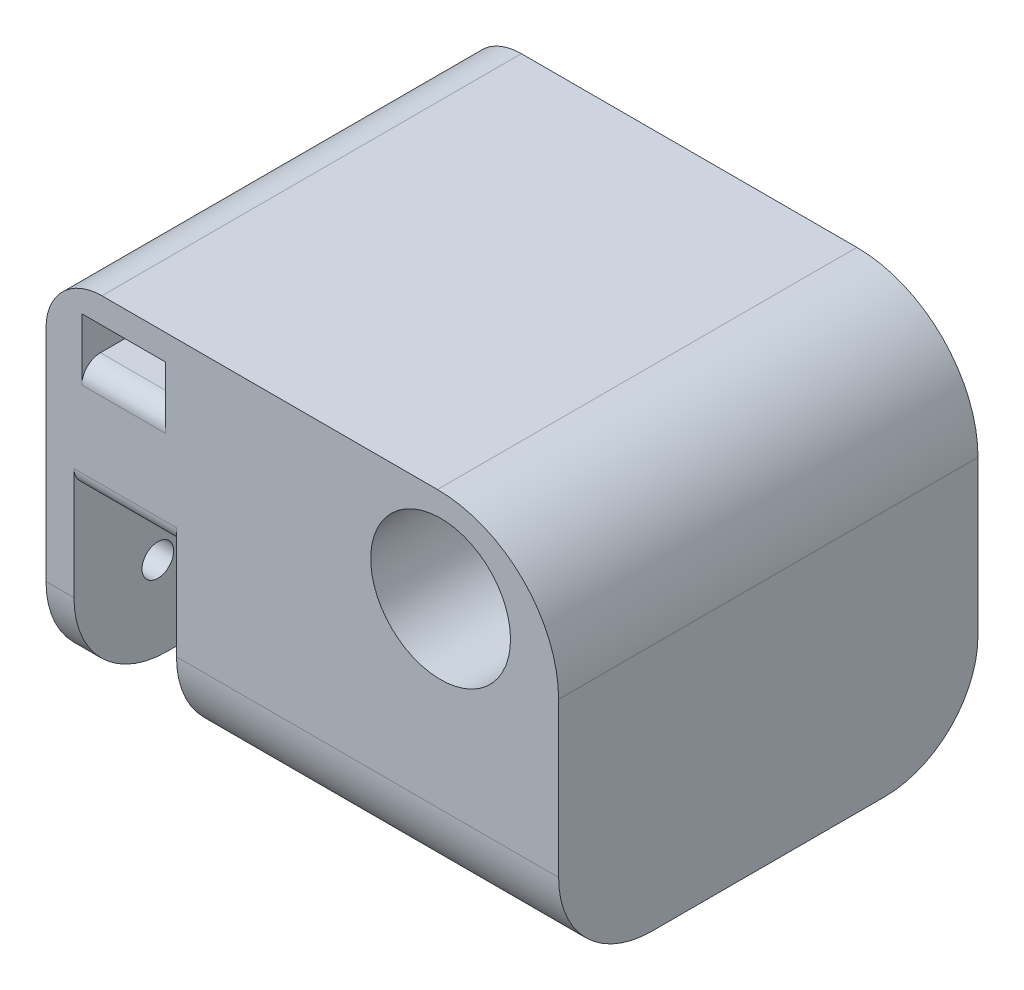
from build123d import *

# Parameters (mm, degrees)
SKETCH1_W                      = 55
SKETCH1_H                      = 39.55
SKETCH1_R                      = 7.5
BOSS_EXTRUDE1_DEPTH            = 45
SKETCH3_R                      = 4
CUT_EXTRUDE1_DEPTH             = 9.55
SKETCH4_W                      = 11
SKETCH4_H                      = 20
CUT_EXTRUDE2_DEPTH             = 65.21216785
M3_CLEARANCE_HOLE1_D           = 3.4
M3_CLEARANCE_HOLE1_DEPTH       = 32
M3_CLEARANCE_HOLE1_CSINK_D     = 3.45
M3_CLEARANCE_HOLE1_CSINK_ANGLE = 90
M3_CLEARANCE_HOLE1_TIP         = 1.021463052
SKETCH8_W                      = 9
SKETCH8_H                      = 4.627198444
CUT_EXTRUDE3_DEPTH             = 65.21216785
FILLET1_R                      = 10
FILLET2_R                      = 2
FILLET3_R                      = 6
FILLET4_R                      = 13


with BuildPart() as part:
    # Sketch1 → Boss-Extrude1 (new body)
    with BuildSketch(Plane.XY):
        with Locations((-7.5, 9.775)):
            Rectangle(SKETCH1_W, SKETCH1_H)
        with Locations((7.34, 19.55)):
            Circle(SKETCH1_R, mode=Mode.SUBTRACT)
    extrude(amount=-BOSS_EXTRUDE1_DEPTH)

    # Sketch3 → Cut-Extrude1 (cut)
    with BuildSketch(Plane.XZ.offset(10)):
        with Locations((7.34, -11.25)):
            Circle(SKETCH3_R)
        with Locations((7.34, -33.75)):
            Circle(SKETCH3_R)
    extrude(amount=-CUT_EXTRUDE1_DEPTH, mode=Mode.SUBTRACT)

    # Sketch4 → Cut-Extrude2 (cut, through all)
    with BuildSketch(Plane.XY):
        with Locations((-26.5, 0)):
            Rectangle(SKETCH4_W, SKETCH4_H)
    extrude(amount=-CUT_EXTRUDE2_DEPTH, mode=Mode.SUBTRACT)

    # M3 Clearance Hole1
    with Locations(Plane(origin=(-35, -1, -36), x_dir=(0, 0, -1), z_dir=(-1, 0, 0))):
        with Locations((0, 0), (-27, 0)):
            CounterSinkHole(M3_CLEARANCE_HOLE1_D / 2, M3_CLEARANCE_HOLE1_CSINK_D / 2, depth=M3_CLEARANCE_HOLE1_DEPTH, counter_sink_angle=M3_CLEARANCE_HOLE1_CSINK_ANGLE)
            with Locations((0, 0, -(M3_CLEARANCE_HOLE1_DEPTH + M3_CLEARANCE_HOLE1_TIP / 2))):  # 118° drill point
                Cone(0, M3_CLEARANCE_HOLE1_D / 2, M3_CLEARANCE_HOLE1_TIP, mode=Mode.SUBTRACT)

    # Sketch8 → Cut-Extrude3 (cut, through all)
    with BuildSketch(Plane.XY):
        with Locations((-26.66, 24.492052806)):
            Rectangle(SKETCH8_W, SKETCH8_H)
    extrude(amount=-CUT_EXTRUDE3_DEPTH, mode=Mode.SUBTRACT)

    # Fillet1
    # the kernel refuses this fillet: 10 mm, written as the material it takes off along each edge
    with BuildSketch(Plane(origin=(-46, -10, 0), x_dir=(0, 1, 0), z_dir=(1, 0, 0))) as fillet1_piece_1:
        with BuildLine():
            CenterArc((FILLET1_R, -FILLET1_R), FILLET1_R, 90, 90)
            Line((0, -FILLET1_R), (0, 0))
            Line((0, 0), (FILLET1_R, 0))
        make_face()
    extrude(amount=91, mode=Mode.SUBTRACT)
    with BuildSketch(Plane(origin=(-46, -10, -45), x_dir=(0, 1, 0), z_dir=(1, 0, 0))) as fillet1_piece_2:
        with BuildLine():
            CenterArc((FILLET1_R, FILLET1_R), FILLET1_R, 180, 90)
            Line((0, FILLET1_R), (0, 0))
            Line((0, 0), (FILLET1_R, 0))
        make_face()
    extrude(amount=91, mode=Mode.SUBTRACT)
    with BuildSketch(Plane(origin=(-60, -10, 0), x_dir=(0, 1, 0), z_dir=(1, 0, 0))) as fillet1_piece_3:
        with BuildLine():
            CenterArc((FILLET1_R, -FILLET1_R), FILLET1_R, 90, 90)
            Line((0, -FILLET1_R), (0, 0))
            Line((0, 0), (FILLET1_R, 0))
        make_face()
    extrude(amount=53, mode=Mode.SUBTRACT)
    with BuildSketch(Plane(origin=(-60, -10, -45), x_dir=(0, 1, 0), z_dir=(1, 0, 0))) as fillet1_piece_4:
        with BuildLine():
            CenterArc((FILLET1_R, FILLET1_R), FILLET1_R, 180, 90)
            Line((0, FILLET1_R), (0, 0))
            Line((0, 0), (FILLET1_R, 0))
        make_face()
    extrude(amount=53, mode=Mode.SUBTRACT)

    # Fillet2
    fillet2_edges = [part.edges().sort_by_distance(p)[0] for p in [
        (-26.5, 10, -45),
        (-26.5, 10, 0),
        (-26.66, 22.178453584, -45),
        (-26.66, 22.178453584, 0),
    ]]
    fillet(fillet2_edges, radius=FILLET2_R)

    # Fillet3
    fillet3_edges = [part.edges().sort_by_distance(p)[0] for p in [
        (-35, 29.55, -22.5),
    ]]
    fillet(fillet3_edges, radius=FILLET3_R)

    # Fillet4
    fillet4_edges = [part.edges().sort_by_distance(p)[0] for p in [
        (20, 29.55, -22.5),
    ]]
    fillet(fillet4_edges, radius=FILLET4_R)


solid = part.part
